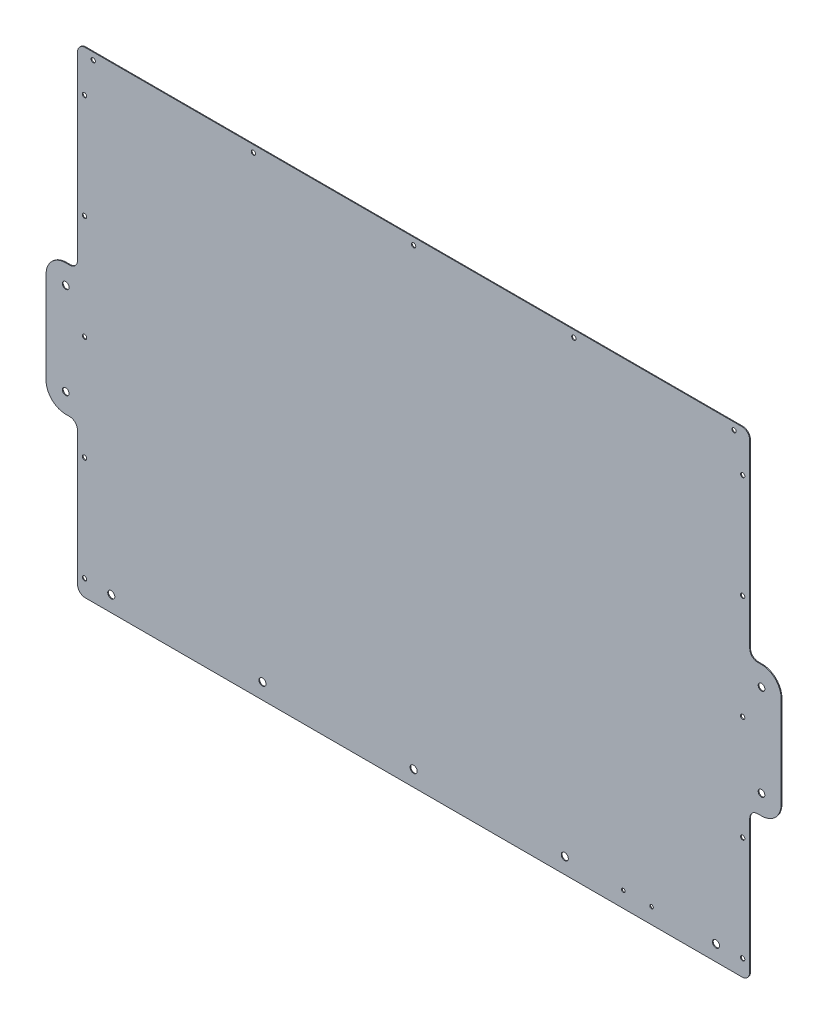
from build123d import *

# Parameters (mm, degrees)
SKETCH1_W            = 856
SKETCH1_H            = 606.9
BASE_FLANGE1_DEPTH   = 1
M5_CLEARANCE_HOLE1_D = 5.5
M8_CLEARANCE_HOLE1_D = 9
LPATTERN1_COUNT      = 5
LPATTERN1_PITCH      = 192.5
FILLET1_R            = 10
M4_CLEARANCE_HOLE1_D = 4.5
SKETCH8_R            = 4.25
BOSS_EXTRUDE1_DEPTH  = 1
FILLET2_R            = 10


# Sheet-metal steps are written as plain solids
with BuildPart() as part:
    # Sketch1 → Base-Flange1 (new body)
    with BuildSketch(Plane.XY):
        Rectangle(SKETCH1_W, SKETCH1_H)
    extrude(amount=-BASE_FLANGE1_DEPTH)

    # M5 Clearance Hole1 (through all)
    with Locations(Plane(origin=(0, 0, -1), x_dir=(-1, 0, 0), z_dir=(0, 0, -1))):
        with Locations((-419, -282.45), (-419, -149.225), (-419, -16), (-419, 117.225), (-419, 250.45), (-408, 294.45), (-204, 294.45), (0, 294.45), (204, 294.45), (408, 294.45), (419, 250.45), (419, 117.225), (419, -16), (419, -149.225), (419, -282.45)):
            Hole(M5_CLEARANCE_HOLE1_D / 2)

    # M8 Clearance Hole1 (through all)
    with Locations(Plane.XY):
        with Locations((-385, -283.45)):
            m8_clearance_hole1 = Hole(M8_CLEARANCE_HOLE1_D / 2)

    # LPattern1: M8 Clearance Hole1 ×5
    with Locations(*[(i * LPATTERN1_PITCH, 0, 0) for i in range(1, LPATTERN1_COUNT)]):
        add(m8_clearance_hole1, mode=Mode.SUBTRACT)

    # Fillet1
    fillet1_edges = [part.edges().sort_by_distance(p)[0] for p in [
        (428, -303.45, -0.5),
        (-428, -303.45, -0.5),
        (-428, 303.45, -0.5),
        (428, 303.45, -0.5),
    ]]
    fillet(fillet1_edges, radius=FILLET1_R)

    # M4 Clearance Hole1 (through all)
    with Locations(Plane.XY):
        with Locations((267, -283.45), (303, -283.45)):
            Hole(M4_CLEARANCE_HOLE1_D / 2)

    # Sketch8 → Boss-Extrude1 (add)
    with BuildSketch(Plane.XY):
        with BuildLine():
            Line((-428, 53.55), (-443, 53.55))
            ThreePointArc((-443, 53.55), (-460.67766953, 46.22766953), (-468, 28.55))
            Line((-468, 28.55), (-468, -88.45))
            ThreePointArc((-468, -88.45), (-460.67766953, -106.12766953), (-443, -113.45))
            Line((-443, -113.45), (-428, -113.45))
            Line((-428, -113.45), (-428, 53.55))
        make_face()
        with Locations((-443, 28.55)):
            Circle(SKETCH8_R, mode=Mode.SUBTRACT)
        with Locations((-443, -88.45)):
            Circle(SKETCH8_R, mode=Mode.SUBTRACT)
    boss_extrude1 = extrude(amount=-BOSS_EXTRUDE1_DEPTH)

    # Mirror3: Boss-Extrude1 across plane
    add(boss_extrude1.mirror(Plane(origin=(0, 0, 0), x_dir=(0, 0, 1), z_dir=(1, 0, 0))))

    # Fillet2
    fillet2_edges = [part.edges().sort_by_distance(p)[0] for p in [
        (-428, 53.55, -0.5),
        (-428, -113.45, -0.5),
        (428, -113.45, -0.5),
        (428, 53.55, -0.5),
    ]]
    fillet(fillet2_edges, radius=FILLET2_R)


solid = part.part
